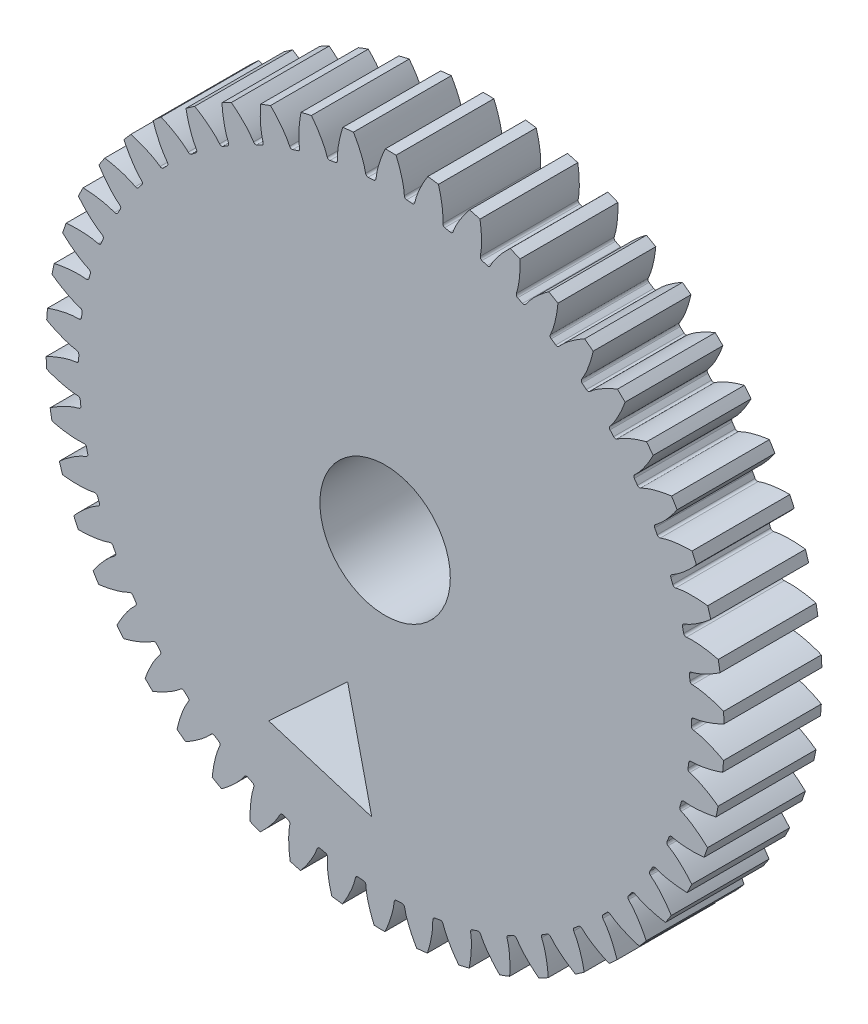
from build123d import *

# Parameters (mm, degrees)
SKETCH_3_R               = 46.984631
SKETCH_3_R_2             = 10
EXTRUDE_1_DEPTH          = 7.5
EXTRUDE_2_DEPTH          = 7.5
PATTERN_CIRCULAR_1_COUNT = 50
CUT_EXTRUDE_1_DEPTH      = 193.508870984


with BuildPart() as part:
    # 草图3 → 凸台-拉伸1 (new, symmetric)
    with BuildSketch(Plane.XY):
        with Locations((-111.201269953, -49.034383213)):
            Circle(SKETCH_3_R)
        with Locations((-111.201269953, -49.034383213)):
            Circle(SKETCH_3_R_2, mode=Mode.SUBTRACT)
    extrude(amount=EXTRUDE_1_DEPTH, both=True)

    # 草图2 → 凸台-拉伸2 (add, symmetric)
    with BuildSketch(Plane.XY):
        with BuildLine():
            ThreePointArc((-59.225575745, -47.444662605), (-59.257078741, -46.625856837), (-59.301480096, -45.807649135))
            add(Edge.make_bspline(
                [(-64.078843643, -44.672776908), (-64.056297486, -44.673030675), (-64.01277728, -44.673873949), (-63.903379268, -44.676841619), (-63.793592963, -44.682973729), (-63.642976026, -44.692715296), (-63.497864785, -44.705994292), (-63.34179594, -44.722053625), (-63.192489217, -44.740414987), (-63.039523171, -44.761092899), (-62.88930566, -44.783769921), (-62.737827726, -44.808543762), (-62.551918959, -44.841350487), (-62.327738447, -44.884649761), (-62.068888198, -44.939359377), (-61.771206768, -45.009169772), (-61.477373889, -45.083600351), (-61.178654031, -45.16598737), (-60.891550668, -45.249550273), (-60.589413415, -45.344575991), (-60.315884026, -45.433568815), (-59.999258287, -45.544735991), (-59.757976277, -45.63097705), (-59.486470507, -45.735108371), (-59.364369009, -45.782730364), (-59.301480096, -45.807649135)],
                knots=[0.026413736, 0.026413736, 0.026413736, 0.026413736, 0.026413736, 0.04469152, 0.062971423, 0.090148742, 0.117568953, 0.144988481, 0.172408466, 0.199828303, 0.227248012, 0.254668085, 0.282087677, 0.309507569, 0.363095809, 0.417935348, 0.472775063, 0.527614648, 0.582454225, 0.637293808, 0.692133468, 0.746973054, 0.801812678, 0.856652296, 0.911493717, 0.911493717, 0.911493717, 0.911493717, 0.911493717], degree=4))
            ThreePointArc((-64.078843643, -44.672776908), (-64.331048439, -44.573193139), (-64.45266302, -44.330841989))
            ThreePointArc((-64.45266302, -44.330841989), (-64.267065017, -46.85815777), (-64.217998457, -49.391804184))
            ThreePointArc((-64.217998457, -49.391804184), (-64.119333681, -49.139241048), (-63.877429527, -49.016745107))
            add(Edge.make_bspline(
                [(-63.877429527, -49.016745107), (-63.855006771, -49.014406438), (-63.811751327, -49.009539615), (-63.703097315, -48.996461467), (-63.5943495, -48.980196527), (-63.445280245, -48.956559329), (-63.302020402, -48.929909353), (-63.14810725, -48.899477002), (-63.001140225, -48.867378235), (-62.850743941, -48.83263424), (-62.703269389, -48.79615405), (-62.554733852, -48.757469403), (-62.372658539, -48.707600261), (-62.153446625, -48.643742091), (-61.900769592, -48.565314352), (-61.610825347, -48.468257358), (-61.325140672, -48.366956132), (-61.03532624, -48.257280385), (-60.757187273, -48.147508738), (-60.465139638, -48.02493229), (-60.201018864, -47.911010095), (-59.896038567, -47.771020745), (-59.663772175, -47.662822539), (-59.403067188, -47.534014058), (-59.285896311, -47.475297659), (-59.225575745, -47.444662605)],
                knots=[0.026413736, 0.026413736, 0.026413736, 0.026413736, 0.026413736, 0.04469152, 0.062971423, 0.090148742, 0.117568953, 0.144988481, 0.172408466, 0.199828303, 0.227248012, 0.254668085, 0.282087677, 0.309507569, 0.363095809, 0.417935348, 0.472775063, 0.527614648, 0.582454225, 0.637293808, 0.692133468, 0.746973054, 0.801812678, 0.856652296, 0.911493717, 0.911493717, 0.911493717, 0.911493717, 0.911493717], degree=4))
        make_face()
    extrude_2 = extrude(amount=EXTRUDE_2_DEPTH, both=True)

    # 阵列(圆周)1: 凸台-拉伸2 ×50 about axis
    pattern_circular_1_axis = Axis((-111.201269953, -49.034383213, 7.5), (0, 0, -1))
    for i in range(1, PATTERN_CIRCULAR_1_COUNT):
        add(extrude_2.rotate(pattern_circular_1_axis, i * 360 / PATTERN_CIRCULAR_1_COUNT))

    # 草图4 → 切除-拉伸1 (cut, through all)
    with BuildSketch(Plane.XY.offset(7.5)):
        Polygon((-116.944775108, -70.69761227), (-129.045999886, -81.952658541), (-113.248231506, -86.80510348), align=None)
    extrude(amount=-CUT_EXTRUDE_1_DEPTH, mode=Mode.SUBTRACT)


solid = part.part
